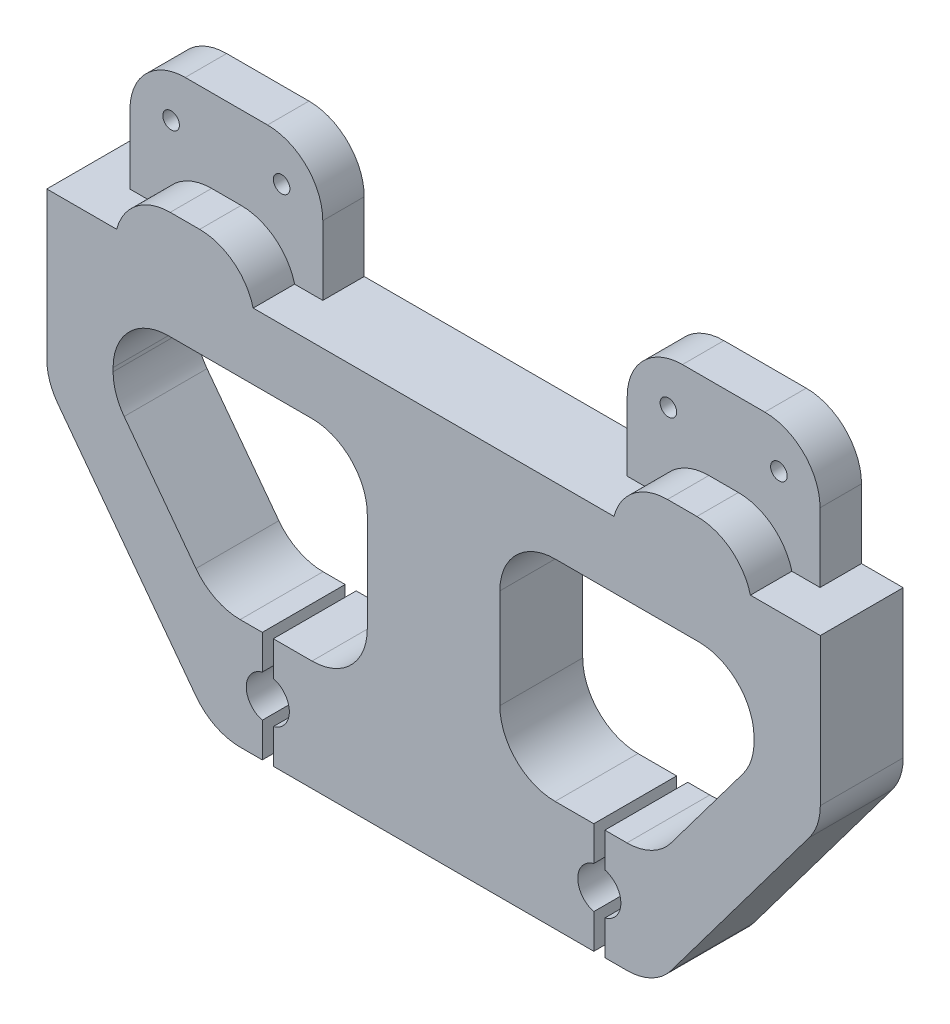
from build123d import *

# Parameters (mm, degrees)
BOSS_EXTRU_1_DEPTH           = 7.5
BOSS_EXTRU_1_DEPTH_BACK      = 7.5
ENL_V_MAT_EXTRU_1_DEPTH      = 7.5
CONG_1_R                     = 10
CONG_2_R                     = 10
ENL_V_MAT_EXTRU_3_DEPTH      = 100.278648258
ENL_V_MAT_EXTRU_3_DEPTH_BACK = 100.278648258
ENL_V_MAT_EXTRU_2_DEPTH      = 100.278648258
ENL_V_MAT_EXTRU_2_DEPTH_BACK = 100.278648258
ESQUISSE8_R                  = 1.5
ENL_V_MAT_EXTRU_4_DEPTH      = 100.278648258


with BuildPart() as part:
    # Esquisse1 → Boss.-Extru.1 (new, two sides: drawn at the far end of the back side and taken through both)
    with BuildSketch(Plane.XY.offset(-BOSS_EXTRU_1_DEPTH_BACK)):
        Polygon((-62.45, 0), (-70, 0), (-70, -30), (-40, -70), (0, -70), (0, 0), (-27.55, 0), (-27.55, 22.5), (-62.45, 22.5), align=None)
    extrude(amount=BOSS_EXTRU_1_DEPTH + BOSS_EXTRU_1_DEPTH_BACK)

    # Esquisse3 → Enlèv. mat.-Extru.1 (cut)
    with BuildSketch(Plane.XY):
        Polygon((-32.65, 0), (-32.65, 7.5), (-57.35, 7.5), (-57.35, 0), (-62.45, 0), (-62.45, 22.5), (-27.55, 22.5), (-27.55, 0), align=None)
    extrude(amount=ENL_V_MAT_EXTRU_1_DEPTH, mode=Mode.SUBTRACT)

    # Congé1
    # the kernel refuses this fillet: 10 mm, written as the material it takes off along each edge
    with BuildSketch(Plane(origin=(-62.45, 22.5, 25), x_dir=(1, 0, 0), z_dir=(0, 0, -1))) as cong_1_piece_1:
        with BuildLine():
            CenterArc((CONG_1_R, CONG_1_R), CONG_1_R, 180, 90)
            Line((0, CONG_1_R), (0, 0))
            Line((0, 0), (CONG_1_R, 0))
        make_face()
    extrude(amount=57.5, mode=Mode.SUBTRACT)
    with BuildSketch(Plane(origin=(-57.35, 7.5, 0), x_dir=(1, 0, 0), z_dir=(0, 0, 1))) as cong_1_piece_2:
        with BuildLine():
            CenterArc((9.682458366, -10), CONG_1_R, 90, 75.522487814)
            Line((0, -7.5), (0, 0))
            Line((0, 0), (9.682458366, 0))
        make_face()
    extrude(amount=31.706145914, mode=Mode.SUBTRACT)
    with BuildSketch(Plane(origin=(-32.65, 7.5, 0), x_dir=(0, -1, 0), z_dir=(0, 0, 1))) as cong_1_piece_3:
        with BuildLine():
            CenterArc((10, -9.682458366), CONG_1_R, 104.477512186, 75.522487814)
            Line((0, -9.682458366), (0, 0))
            Line((0, 0), (7.5, 0))
        make_face()
    extrude(amount=31.706145914, mode=Mode.SUBTRACT)
    with BuildSketch(Plane(origin=(-27.55, 22.5, 25), x_dir=(-1, 0, 0), z_dir=(0, 0, -1))) as cong_1_piece_4:
        with BuildLine():
            CenterArc((CONG_1_R, -CONG_1_R), CONG_1_R, 90, 90)
            Line((0, -CONG_1_R), (0, 0))
            Line((0, 0), (CONG_1_R, 0))
        make_face()
    extrude(amount=57.5, mode=Mode.SUBTRACT)

    # Congé2
    cong_2_edges = [part.edges().sort_by_distance(p)[0] for p in [
        (-40, -70, 0),
        (-70, -30, 0),
    ]]
    fillet(cong_2_edges, radius=CONG_2_R)

    # Esquisse6 → Enlèv. mat.-Extru.3 (cut, two sides: drawn at the far end of the back side and taken through both)
    with BuildSketch(Plane.XY.offset(-ENL_V_MAT_EXTRU_3_DEPTH_BACK)):
        with BuildLine():
            Line((-58, -22), (-58, -22.666666667))
            ThreePointArc((-58, -22.666666667), (-57.486832981, -25.828944327), (-56, -28.666666667))
            Line((-56, -28.666666667), (-43, -46))
            ThreePointArc((-43, -46), (-39.472135955, -48.94427191), (-35, -50))
            Line((-35, -50), (-22, -50))
            ThreePointArc((-22, -50), (-14.928932188, -47.071067812), (-12, -40))
            Line((-12, -40), (-12, -22))
            ThreePointArc((-12, -22), (-14.928932188, -14.928932188), (-22, -12))
            Line((-22, -12), (-48, -12))
            ThreePointArc((-48, -12), (-55.071067812, -14.928932188), (-58, -22))
        make_face()
    extrude(amount=ENL_V_MAT_EXTRU_3_DEPTH + ENL_V_MAT_EXTRU_3_DEPTH_BACK, mode=Mode.SUBTRACT)

    # Esquisse5 → Enlèv. mat.-Extru.2 (cut, two sides: drawn at the far end of the back side and taken through both)
    with BuildSketch(Plane.XY.offset(-ENL_V_MAT_EXTRU_2_DEPTH_BACK)):
        with BuildLine():
            Line((-29, -72.5), (-31, -72.5))
            Line((-31, -72.5), (-31, -63.769615365))
            ThreePointArc((-31, -63.769615365), (-33.9, -60), (-31, -56.230384635))
            Line((-31, -56.230384635), (-31, -47.5))
            Line((-31, -47.5), (-29, -47.5))
            Line((-29, -47.5), (-29, -56.230384635))
            ThreePointArc((-29, -56.230384635), (-26.1, -60), (-29, -63.769615365))
            Line((-29, -63.769615365), (-29, -72.5))
        make_face()
    extrude(amount=ENL_V_MAT_EXTRU_2_DEPTH + ENL_V_MAT_EXTRU_2_DEPTH_BACK, mode=Mode.SUBTRACT)

    # Esquisse8 → Enlèv. mat.-Extru.4 (cut, through all)
    with BuildSketch(Plane.XY):
        with Locations((-55, 14.5)):
            Circle(ESQUISSE8_R)
        with Locations(Location((-35, 14.5, 0), (0, 0, 180))):
            Circle(ESQUISSE8_R)
    extrude(amount=-ENL_V_MAT_EXTRU_4_DEPTH, mode=Mode.SUBTRACT)

    # Symétrie1: part across plane


with BuildPart() as part_1:
    add(part.part)
    add(part.part.mirror(Plane(origin=(0, 0, -7.5), x_dir=(0, 0, 1), z_dir=(1, 0, 0))))


solid = part_1.part
